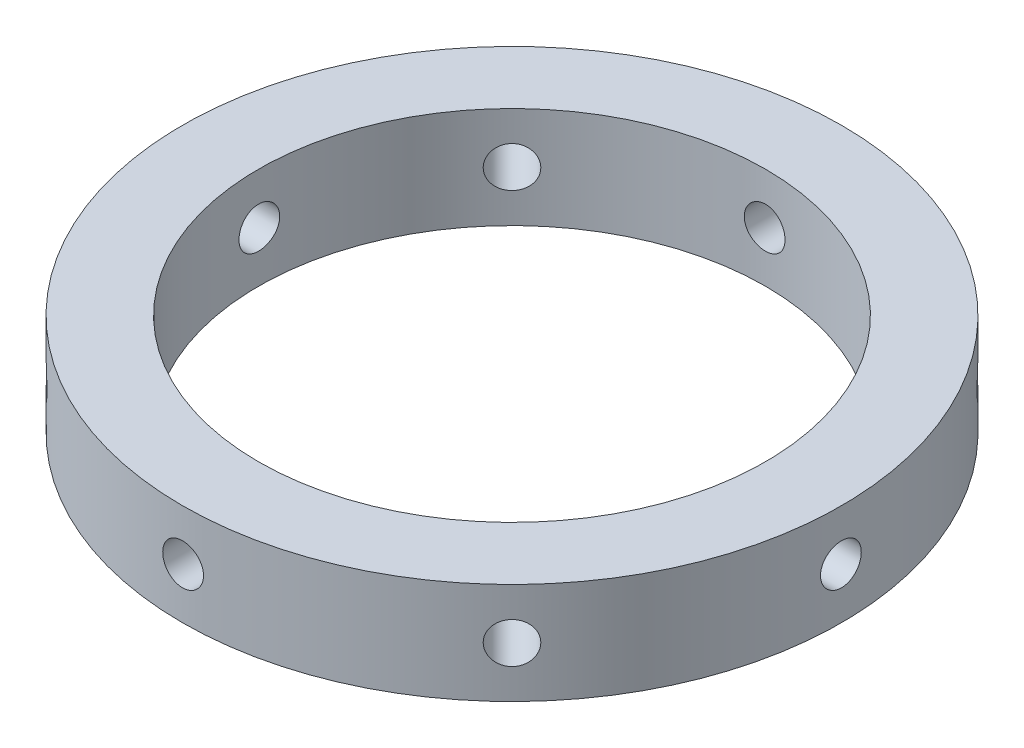
from build123d import *

# Parameters (mm, degrees)
SKETCH1_R           = 41.275
SKETCH1_R_2         = 31.75
BOSS_EXTRUDE1_DEPTH = 12.7
CIRPATTERN1_COUNT   = 8


with BuildPart() as part:
    # Sketch1 → Boss-Extrude1 (new body)
    with BuildSketch(Plane(origin=(0, 0, 0), x_dir=(1, 0, 0), z_dir=(0, 1, 0))):
        Circle(SKETCH1_R)
        Circle(SKETCH1_R_2, mode=Mode.SUBTRACT)
    extrude(amount=BOSS_EXTRUDE1_DEPTH)

    # Sketch3 → #7 (0.201) Diameter Hole1 (revolve, cut)
    with BuildSketch(Plane(origin=(0, 6.35, 41.275), x_dir=(0, -1, 0), z_dir=(1, 0, 0))):
        Polygon((0, 0), (0, 13.217816902), (2.5527, 11.684), (2.5527, 0), align=None)
    f_7_0_201_diameter_hole1 = revolve(axis=Axis((0, 6.35, 47.625), (0, 0, -1)), mode=Mode.SUBTRACT)

    # CirPattern1: #7 (0.201) Diameter Hole1 ×8 about axis
    cirpattern1_axis = Axis((0, -0.3175, 0), (0, 1, 0))
    for i in range(1, CIRPATTERN1_COUNT):
        add(f_7_0_201_diameter_hole1.rotate(cirpattern1_axis, i * 360 / CIRPATTERN1_COUNT), mode=Mode.SUBTRACT)


solid = part.part
